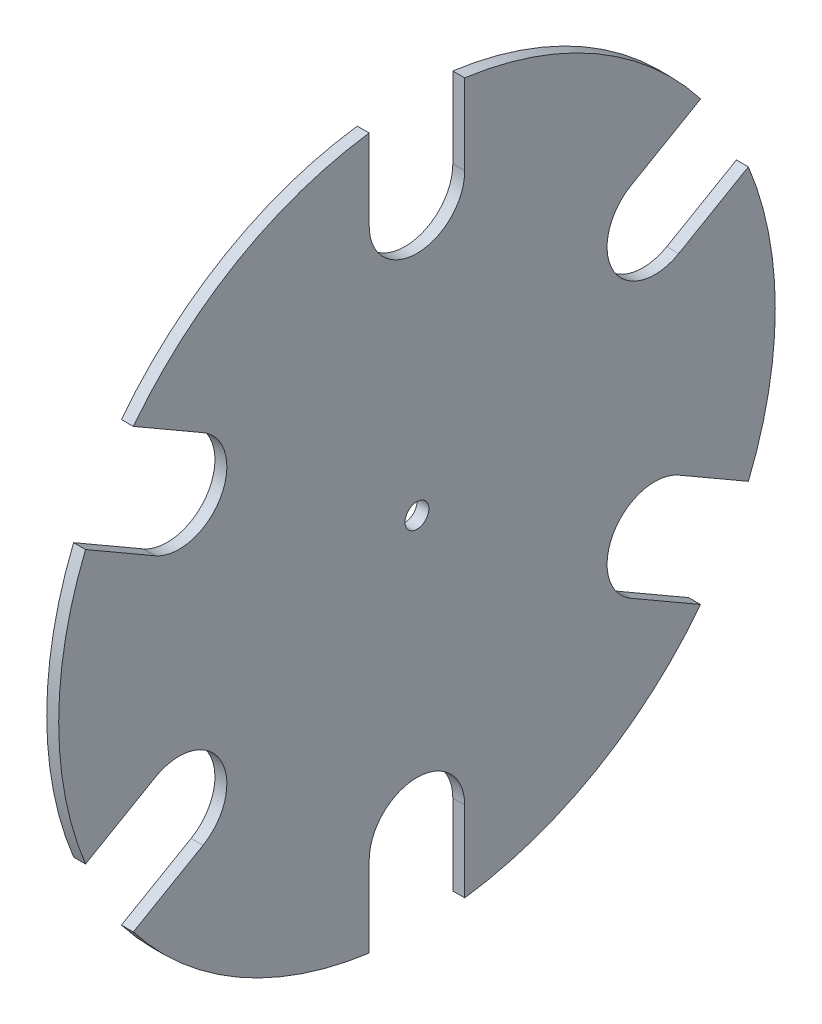
from build123d import *

# Parameters (mm, degrees)
SKETCH1_R           = 300
SKETCH1_R_2         = 10
SKETCH1_R_3         = 40
BOSS_EXTRUDE1_DEPTH = 10
CUT_EXTRUDE1_DEPTH  = 10


with BuildPart() as part:
    # Sketch1 → Boss-Extrude1 (new body)
    with BuildSketch(Plane(origin=(0, 0, 0), x_dir=(0, 0, -1), z_dir=(1, 0, 0))):
        Circle(SKETCH1_R)
        Circle(SKETCH1_R_2, mode=Mode.SUBTRACT)
        with Locations((0, 230)):
            Circle(SKETCH1_R_3, mode=Mode.SUBTRACT)
        with Locations((199.18584287, 115)):
            Circle(SKETCH1_R_3, mode=Mode.SUBTRACT)
        with Locations((199.18584287, -115)):
            Circle(SKETCH1_R_3, mode=Mode.SUBTRACT)
        with Locations((0, -230)):
            Circle(SKETCH1_R_3, mode=Mode.SUBTRACT)
        with Locations((-199.18584287, -115)):
            Circle(SKETCH1_R_3, mode=Mode.SUBTRACT)
        with Locations((-199.18584287, 115)):
            Circle(SKETCH1_R_3, mode=Mode.SUBTRACT)
    extrude(amount=BOSS_EXTRUDE1_DEPTH)

    # Sketch2 → Cut-Extrude1 (cut)
    with BuildSketch(Plane.ZY):
        with BuildLine():
            Line((40, 297.321374946), (40, 230))
            ThreePointArc((40, 230), (0, 270), (-40, 230))
            Line((-40, 230), (-40, 297.321374946))
            ThreePointArc((-40, 297.321374946), (0, 300), (40, 297.321374946))
        make_face()
        with BuildLine():
            Line((277.487863792, 114.019671322), (219.18584287, 80.358983849))
            ThreePointArc((219.18584287, 80.358983849), (233.826859022, 135), (179.18584287, 149.641016151))
            Line((179.18584287, 149.641016151), (237.487863792, 183.301703625))
            ThreePointArc((237.487863792, 183.301703625), (259.807621135, 150), (277.487863792, 114.019671322))
        make_face()
        with BuildLine():
            Line((-237.487863792, 183.301703625), (-179.18584287, 149.641016151))
            ThreePointArc((-179.18584287, 149.641016151), (-233.826859022, 135), (-219.18584287, 80.358983849))
            Line((-219.18584287, 80.358983849), (-277.487863792, 114.019671322))
            ThreePointArc((-277.487863792, 114.019671322), (-259.807621135, 150), (-237.487863792, 183.301703625))
        make_face()
        with BuildLine():
            Line((237.487863792, -183.301703625), (179.18584287, -149.641016151))
            ThreePointArc((179.18584287, -149.641016151), (233.826859022, -135), (219.18584287, -80.358983849))
            Line((219.18584287, -80.358983849), (277.487863792, -114.019671322))
            ThreePointArc((277.487863792, -114.019671322), (259.807621135, -150), (237.487863792, -183.301703625))
        make_face()
        with BuildLine():
            Line((-40, -297.321374946), (-40, -230))
            ThreePointArc((-40, -230), (0, -270), (40, -230))
            Line((40, -230), (40, -297.321374946))
            ThreePointArc((40, -297.321374946), (0, -300), (-40, -297.321374946))
        make_face()
        with BuildLine():
            Line((-277.487863792, -114.019671322), (-219.18584287, -80.358983849))
            ThreePointArc((-219.18584287, -80.358983849), (-233.826859022, -135), (-179.18584287, -149.641016151))
            Line((-179.18584287, -149.641016151), (-237.487863792, -183.301703625))
            ThreePointArc((-237.487863792, -183.301703625), (-259.807621135, -150), (-277.487863792, -114.019671322))
        make_face()
    extrude(amount=-CUT_EXTRUDE1_DEPTH, mode=Mode.SUBTRACT)


solid = part.part
